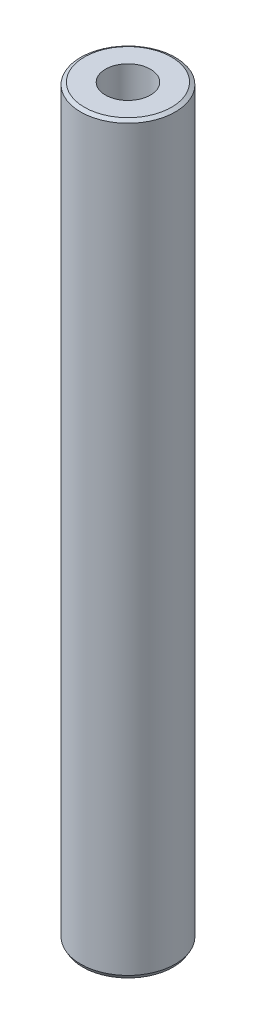
from build123d import *
from OCP.BRepFilletAPI import BRepFilletAPI_MakeChamfer

# Parameters (mm, degrees)
SKETCH1_R           = 7.5
BOSS_EXTRUDE1_DEPTH = 117.883172153
SKETCH2_R           = 3.562593558
CUT_EXTRUDE1_DEPTH  = 119.359377646
CHAMFER1_SIZE       = 0.344213401
CHAMFER1_SIZE2      = 0.5961951


with BuildPart() as part:
    # Sketch1 → Boss-Extrude1 (new body)
    with BuildSketch(Plane(origin=(0, 0, 0), x_dir=(1, 0, 0), z_dir=(0, 1, 0))):
        Circle(SKETCH1_R)
    extrude(amount=BOSS_EXTRUDE1_DEPTH)

    # Sketch2 → Cut-Extrude1 (cut, through all)
    with BuildSketch(Plane(origin=(0, 0, 0), x_dir=(1, 0, 0), z_dir=(0, 1, 0))):
        Circle(SKETCH2_R)
    extrude(amount=CUT_EXTRUDE1_DEPTH, mode=Mode.SUBTRACT)

    # Chamfer1: one chamfer whose edges measure the first distance from different faces: ONE call of the kernel's chamfer builder (chamfer() names one face for all edges)
    chamfer1_edges_1 = [part.edges().sort_by_distance(p)[0] for p in [
        (-7.5, 117.883172153, 0),
    ]]
    chamfer1_side_1 = [part.faces().sort_by_distance(p)[0] for p in [
        (-7.5, 58.941586076, 0),
    ]]
    chamfer1_edges_2 = [part.edges().sort_by_distance(p)[0] for p in [
        (-7.5, 0, 0),
    ]]
    chamfer1_side_2 = [part.faces().sort_by_distance(p)[0] for p in [
        (-7.287867966, 0, 0),
    ]]
    chamfer1 = BRepFilletAPI_MakeChamfer(part.part.solid().wrapped)
    for e in chamfer1_edges_1:
        chamfer1.Add(CHAMFER1_SIZE, CHAMFER1_SIZE2, e.wrapped, chamfer1_side_1[0].wrapped)  # the first distance lies on this face
    for e in chamfer1_edges_2:
        chamfer1.Add(CHAMFER1_SIZE, CHAMFER1_SIZE2, e.wrapped, chamfer1_side_2[0].wrapped)  # the first distance lies on this face
    add(Compound.cast(chamfer1.Shape()), mode=Mode.REPLACE)


solid = part.part
